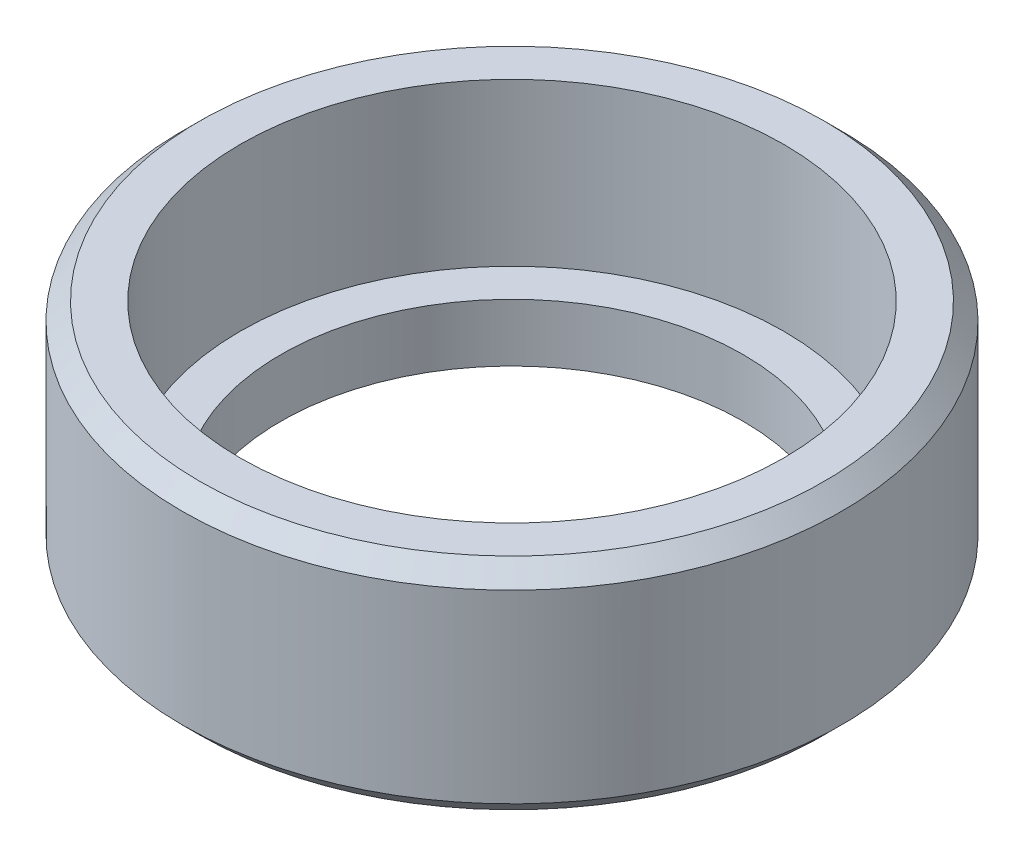
from build123d import *

# Parameters (mm, degrees)
CHAMFER_1_SIZE = 1.5


with BuildPart() as part:
    # Эскиз1 → Повернуть1 (revolve)
    with BuildSketch(Plane(origin=(0, 0, 0), x_dir=(0, 0, -1), z_dir=(1, 0, 0))):
        Polygon((-20, 5), (-20, 0), (-28.5, 0), (-28.5, 19), (-23.5, 19), (-23.5, 5), align=None)
    revolve(axis=Axis((0, 19.771159875, 0), (0, -1, 0)))

    # Фаска1
    chamfer_1_edges = [part.edges().sort_by_distance(p)[0] for p in [
        (0, 19, -28.5),
        (0, 0, -28.5),
    ]]
    chamfer(chamfer_1_edges, length=CHAMFER_1_SIZE)


solid = part.part
